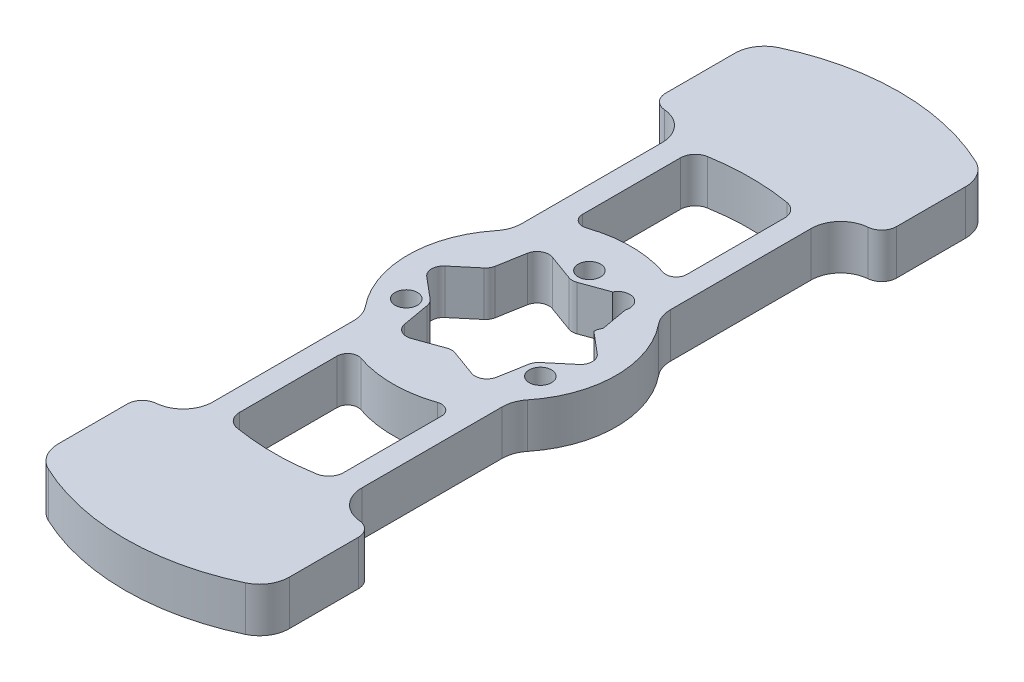
from build123d import *

# Parameters (mm, degrees)
SKETCH1_R           = 2.38125
BOSS_EXTRUDE1_DEPTH = 9.525


with BuildPart() as part:
    # Sketch1 → Boss-Extrude1 (new body)
    with BuildSketch(Plane(origin=(0, 0, 0), x_dir=(1, 0, 0), z_dir=(0, 1, 0))):
        with BuildLine():
            Line((-15.875, 47.889129042), (-15.875, 17.960512242))
            ThreePointArc((-15.875, 17.960512242), (-16.238162586, 15.843845575), (-17.286111111, 13.969287299))
            ThreePointArc((-17.286111111, 13.969287299), (-22.225, 0), (-17.286111111, -13.969287299))
            ThreePointArc((-17.286111111, -13.969287299), (-16.238162586, -15.843845575), (-15.875, -17.960512242))
            Line((-15.875, -17.960512242), (-15.875, -47.889129042))
            ThreePointArc((-15.875, -47.889129042), (-17.556159451, -52.193130427), (-21.709465489, -54.218167213))
            ThreePointArc((-21.709465489, -54.218167213), (-23.786118507, -55.230685605), (-24.626698233, -57.382686298))
            Line((-24.626698233, -57.382686298), (-24.626698233, -72.115493118))
            ThreePointArc((-24.626698233, -72.115493118), (-23.638035305, -75.51822214), (-20.97990617, -77.861375718))
            ThreePointArc((-20.97990617, -77.861375718), (0, -82.55), (20.97990617, -77.861375718))
            ThreePointArc((20.97990617, -77.861375718), (23.638035305, -75.51822214), (24.626698233, -72.115493118))
            Line((24.626698233, -72.115493118), (24.626698233, -57.382686298))
            ThreePointArc((24.626698233, -57.382686298), (23.786118507, -55.230685605), (21.709465489, -54.218167213))
            ThreePointArc((21.709465489, -54.218167213), (17.556159451, -52.193130427), (15.875, -47.889129042))
            Line((15.875, -47.889129042), (15.875, -17.960512242))
            ThreePointArc((15.875, -17.960512242), (16.238162586, -15.843845575), (17.286111111, -13.969287299))
            ThreePointArc((17.286111111, -13.969287299), (22.225, 0), (17.286111111, 13.969287299))
            ThreePointArc((17.286111111, 13.969287299), (16.238162586, 15.843845575), (15.875, 17.960512242))
            Line((15.875, 17.960512242), (15.875, 47.889129042))
            ThreePointArc((15.875, 47.889129042), (17.556159451, 52.193130427), (21.709465489, 54.218167213))
            ThreePointArc((21.709465489, 54.218167213), (23.786118507, 55.230685605), (24.626698233, 57.382686298))
            Line((24.626698233, 57.382686298), (24.626698233, 72.115493118))
            ThreePointArc((24.626698233, 72.115493118), (23.638035305, 75.51822214), (20.97990617, 77.861375718))
            ThreePointArc((20.97990617, 77.861375718), (0, 82.55), (-20.97990617, 77.861375718))
            ThreePointArc((-20.97990617, 77.861375718), (-23.638035305, 75.51822214), (-24.626698233, 72.115493118))
            Line((-24.626698233, 72.115493118), (-24.626698233, 57.382686298))
            ThreePointArc((-24.626698233, 57.382686298), (-23.786118507, 55.230685605), (-21.709465489, 54.218167213))
            ThreePointArc((-21.709465489, 54.218167213), (-17.556159451, 52.193130427), (-15.875, 47.889129042))
        make_face()
        with Locations((-14.298079416, -8.255)):
            Circle(SKETCH1_R, mode=Mode.SUBTRACT)
        with Locations((0, 16.51)):
            Circle(SKETCH1_R, mode=Mode.SUBTRACT)
        with Locations((14.298079416, -8.255)):
            Circle(SKETCH1_R, mode=Mode.SUBTRACT)
        with BuildLine():
            Line((6.435925078, 15.035903984), (0.872893577, 13.016814686))
            ThreePointArc((0.872893577, 13.016814686), (0.006721965, 12.862124307), (-0.860256267, 13.012228004))
            Line((-0.860256267, 13.012228004), (-6.435925078, 15.035903984))
            ThreePointArc((-6.435925078, 15.035903984), (-8.572500239, 14.848004066), (-9.803511258, 13.09162379))
            Line((-9.803511258, 13.09162379), (-10.83761762, 7.257733753))
            ThreePointArc((-10.83761762, 7.257733753), (-11.138925375, 6.431059337), (-11.704192542, 5.756781959))
            Line((-11.704192542, 5.756781959), (-16.239436336, 1.944274561))
            ThreePointArc((-16.239436336, 1.944274561), (-17.144998978, -2.816e-06), (-16.239436336, -1.944280194))
            Line((-16.239436336, -1.944280194), (-11.704192542, -5.756787592))
            ThreePointArc((-11.704192542, -5.756787592), (-11.138925375, -6.43106497), (-10.83761762, -7.257739386))
            Line((-10.83761762, -7.257739386), (-9.803511258, -13.091629423))
            ThreePointArc((-9.803511258, -13.091629423), (-8.572498978, -14.848008364), (-6.435924056, -15.035906801))
            Line((-6.435924056, -15.035906801), (-0.859723128, -13.01203769))
            ThreePointArc((-0.859723128, -13.01203769), (0.006721965, -12.862125742), (0.872361459, -13.016621555))
            Line((0.872361459, -13.016621555), (6.435925078, -15.035903984))
            ThreePointArc((6.435925078, -15.035903984), (8.5725, -14.848005548), (9.80351228, -13.091626607))
            Line((9.80351228, -13.091626607), (10.837618642, -7.257736569))
            ThreePointArc((10.837618642, -7.257736569), (11.138927312, -6.431063562), (11.704194586, -5.756787592))
            Line((11.704194586, -5.756787592), (16.239438381, -1.944280194))
            ThreePointArc((16.239438381, -1.944280194), (17.145001022, -2.816e-06), (16.239438381, 1.944274561))
            Line((16.239438381, 1.944274561), (11.704194586, 5.756781959))
            ThreePointArc((11.704194586, 5.756781959), (11.806935184, 6.542177335), (12.146606362, 7.257736569))
            Line((12.146606362, 7.257736569), (11.1125, 13.091626607))
            ThreePointArc((11.1125, 13.091626607), (9.673527732, 16.226890232), (6.435925078, 15.035903984))
        make_face(mode=Mode.SUBTRACT)
        with BuildLine():
            Line((-11.1125, 26.152827882), (-11.1125, 47.019076269))
            ThreePointArc((-11.1125, 47.019076269), (-10.362230703, 49.068785034), (-8.466008019, 50.149779748))
            ThreePointArc((-8.466008019, 50.149779748), (0, 50.859352145), (8.466008019, 50.149779748))
            ThreePointArc((8.466008019, 50.149779748), (10.362230703, 49.068785034), (11.1125, 47.019076269))
            Line((11.1125, 47.019076269), (11.1125, 26.152827882))
            ThreePointArc((11.1125, 26.152827882), (10.184175433, 24.346002988), (8.174712644, 24.048577363))
            ThreePointArc((8.174712644, 24.048577363), (0, 25.4), (-8.174712644, 24.048577363))
            ThreePointArc((-8.174712644, 24.048577363), (-10.184175433, 24.346002988), (-11.1125, 26.152827882))
        make_face(mode=Mode.SUBTRACT)
        with BuildLine():
            Line((11.1125, -47.019076269), (11.1125, -26.152827882))
            ThreePointArc((11.1125, -26.152827882), (10.184175433, -24.346002988), (8.174712644, -24.048577363))
            ThreePointArc((8.174712644, -24.048577363), (0, -25.4), (-8.174712644, -24.048577363))
            ThreePointArc((-8.174712644, -24.048577363), (-10.184175433, -24.346002988), (-11.1125, -26.152827882))
            Line((-11.1125, -26.152827882), (-11.1125, -47.019076269))
            ThreePointArc((-11.1125, -47.019076269), (-10.362230703, -49.068785034), (-8.466008019, -50.149779748))
            ThreePointArc((-8.466008019, -50.149779748), (0, -50.859352145), (8.466008019, -50.149779748))
            ThreePointArc((8.466008019, -50.149779748), (10.362230703, -49.068785034), (11.1125, -47.019076269))
        make_face(mode=Mode.SUBTRACT)
    extrude(amount=BOSS_EXTRUDE1_DEPTH)


solid = part.part
